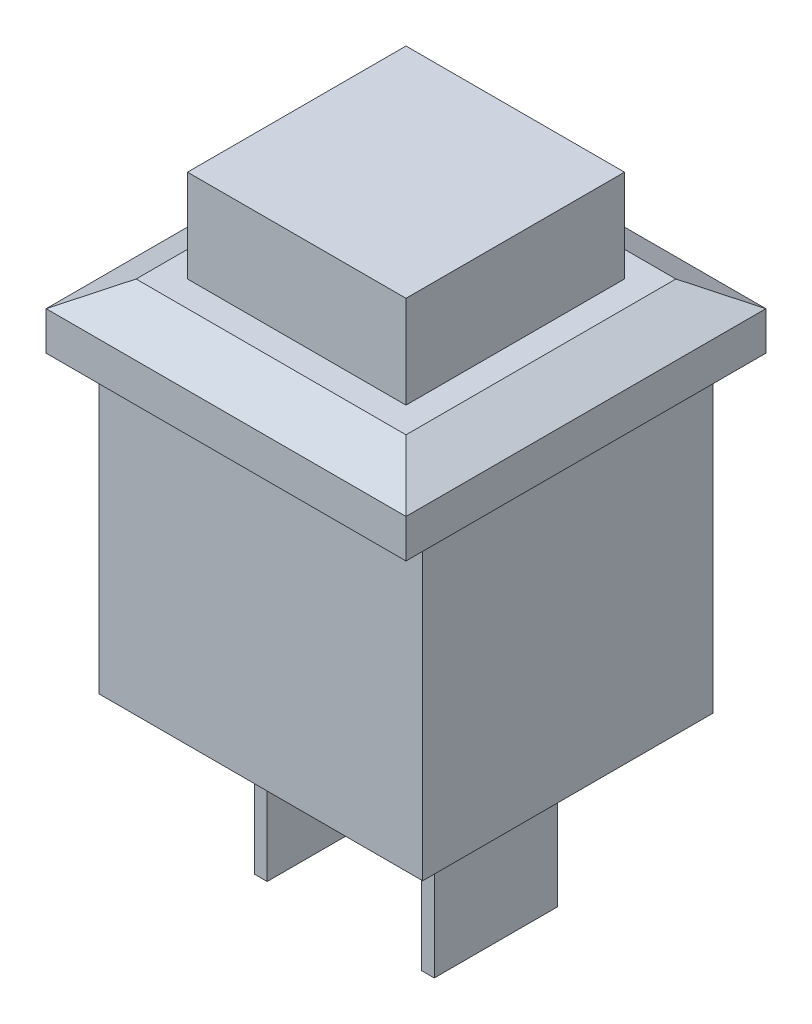
from build123d import *
from OCP.BRepFilletAPI import BRepFilletAPI_MakeChamfer

# Parameters (mm, degrees)
BEZEL_DRAWING_W     = 14
BEZEL_DRAWING_H     = 14
BEZEL_DEPTH         = 2.5
CHAMFER1_SIZE       = 1
CHAMFER1_SIZE2      = 1.75
SKETCH2_W           = 8.5
SKETCH2_H           = 8.5
BOSS_EXTRUDE2_DEPTH = 3.6
SKETCH3_W           = 12.6
SKETCH3_H           = 11.3
BOSS_EXTRUDE3_DEPTH = 11.8
SKETCH4_W           = 0.5
SKETCH4_H           = 4.8
BOSS_EXTRUDE4_DEPTH = 6.3


with BuildPart() as part:
    # Bezel drawing → Bezel (new body)
    with BuildSketch(Plane(origin=(0, 0, 0), x_dir=(1, 0, 0), z_dir=(0, 1, 0))):
        Rectangle(BEZEL_DRAWING_W, BEZEL_DRAWING_H)
    extrude(amount=BEZEL_DEPTH)

    # Chamfer1: one chamfer whose edges measure the first distance from different faces: ONE call of the kernel's chamfer builder (chamfer() names one face for all edges)
    chamfer1_edges_1 = [part.edges().sort_by_distance(p)[0] for p in [
        (0, 2.5, 7),
    ]]
    chamfer1_side_1 = [part.faces().sort_by_distance(p)[0] for p in [
        (0, 1.25, 7),
    ]]
    chamfer1_edges_2 = [part.edges().sort_by_distance(p)[0] for p in [
        (-7, 2.5, 0),
    ]]
    chamfer1_side_2 = [part.faces().sort_by_distance(p)[0] for p in [
        (-7, 1.25, 0),
    ]]
    chamfer1_edges_3 = [part.edges().sort_by_distance(p)[0] for p in [
        (0, 2.5, -7),
    ]]
    chamfer1_side_3 = [part.faces().sort_by_distance(p)[0] for p in [
        (0, 1.25, -7),
    ]]
    chamfer1_edges_4 = [part.edges().sort_by_distance(p)[0] for p in [
        (7, 2.5, 0),
    ]]
    chamfer1_side_4 = [part.faces().sort_by_distance(p)[0] for p in [
        (7, 1.25, 0),
    ]]
    chamfer1 = BRepFilletAPI_MakeChamfer(part.part.solid().wrapped)
    for e in chamfer1_edges_1:
        chamfer1.Add(CHAMFER1_SIZE, CHAMFER1_SIZE2, e.wrapped, chamfer1_side_1[0].wrapped)  # the first distance lies on this face
    for e in chamfer1_edges_2:
        chamfer1.Add(CHAMFER1_SIZE, CHAMFER1_SIZE2, e.wrapped, chamfer1_side_2[0].wrapped)  # the first distance lies on this face
    for e in chamfer1_edges_3:
        chamfer1.Add(CHAMFER1_SIZE, CHAMFER1_SIZE2, e.wrapped, chamfer1_side_3[0].wrapped)  # the first distance lies on this face
    for e in chamfer1_edges_4:
        chamfer1.Add(CHAMFER1_SIZE, CHAMFER1_SIZE2, e.wrapped, chamfer1_side_4[0].wrapped)  # the first distance lies on this face
    add(Compound.cast(chamfer1.Shape()), mode=Mode.REPLACE)

    # Sketch3 → Boss-Extrude3 (add)
    with BuildSketch(Plane.XZ):
        Rectangle(SKETCH3_W, SKETCH3_H)
    extrude(amount=BOSS_EXTRUDE3_DEPTH)

    # Sketch4 → Boss-Extrude4 (add)
    with BuildSketch(Plane.XZ.offset(11.8)):
        with Locations((-3.25, 0)):
            Rectangle(SKETCH4_W, SKETCH4_H)
        with Locations((3.25, 0)):
            Rectangle(SKETCH4_W, SKETCH4_H)
    extrude(amount=BOSS_EXTRUDE4_DEPTH)


with BuildPart() as body_2:
    # Sketch2 → Boss-Extrude2 (new body)
    with BuildSketch(Plane(origin=(0, 2.5, 0), x_dir=(1, 0, 0), z_dir=(0, 1, 0))):
        Rectangle(SKETCH2_W, SKETCH2_H)
    extrude(amount=BOSS_EXTRUDE2_DEPTH)


solid = Compound([part.part, body_2.part])
